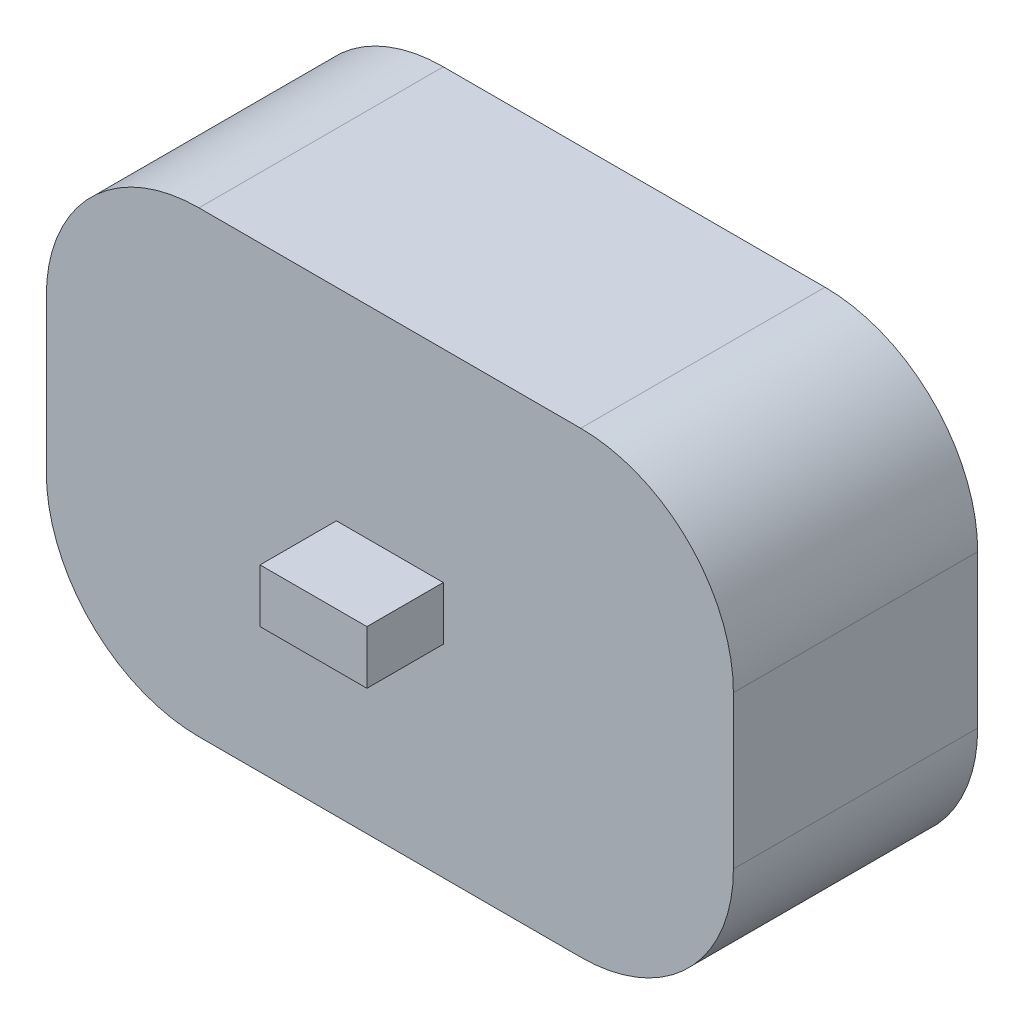
from build123d import *

# Parameters (mm, degrees)
SKETCH1_W           = 45
SKETCH1_H           = 30
BOSS_EXTRUDE1_DEPTH = 16
SKETCH2_W           = 7
SKETCH2_H           = 3.5
BOSS_EXTRUDE2_DEPTH = 5
FILLET1_R           = 10


with BuildPart() as part:
    # Sketch1 → Boss-Extrude1 (new body)
    with BuildSketch(Plane.XY):
        Rectangle(SKETCH1_W, SKETCH1_H)
    extrude(amount=BOSS_EXTRUDE1_DEPTH)

    # Sketch2 → Boss-Extrude2 (add)
    with BuildSketch(Plane.XY.offset(16)):
        Rectangle(SKETCH2_W, SKETCH2_H)
    extrude(amount=BOSS_EXTRUDE2_DEPTH)

    # Fillet1
    fillet1_edges = [part.edges().sort_by_distance(p)[0] for p in [
        (-22.5, 15, 8),
        (22.5, 15, 8),
        (22.5, -15, 8),
        (-22.5, -15, 8),
    ]]
    fillet(fillet1_edges, radius=FILLET1_R)


solid = part.part
